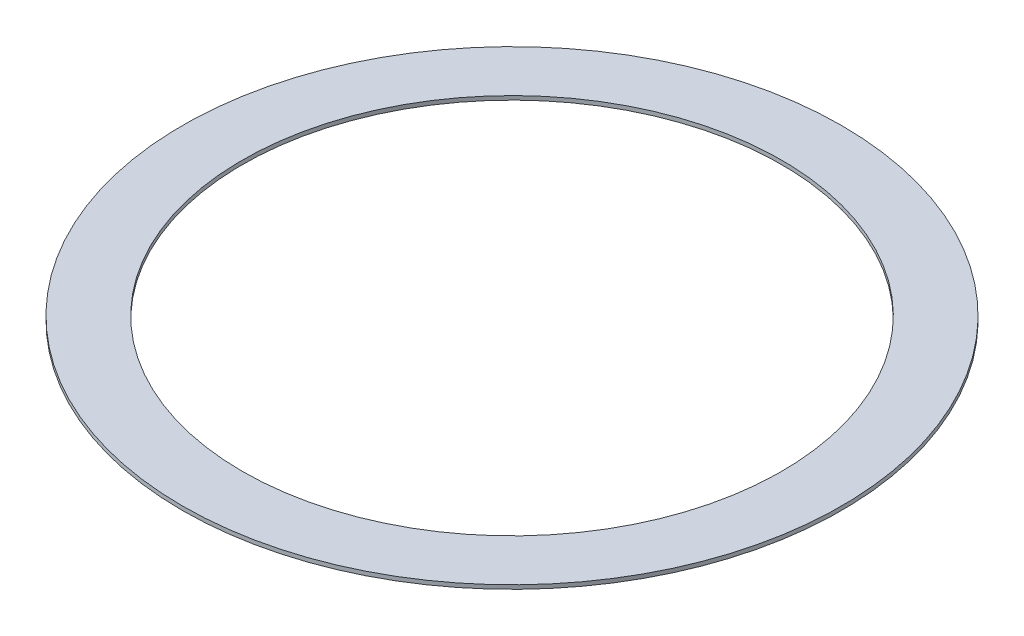
from build123d import *

# Parameters (mm, degrees)
SKETCH1_R           = 69.85
SKETCH1_R_2         = 57.15
BOSS_EXTRUDE1_DEPTH = 0.8382


with BuildPart() as part:
    # Sketch1 → Boss-Extrude1 (new body)
    with BuildSketch(Plane(origin=(0, 0, 0), x_dir=(1, 0, 0), z_dir=(0, 1, 0))):
        Circle(SKETCH1_R)
        Circle(SKETCH1_R_2, mode=Mode.SUBTRACT)
    extrude(amount=BOSS_EXTRUDE1_DEPTH)


solid = part.part
